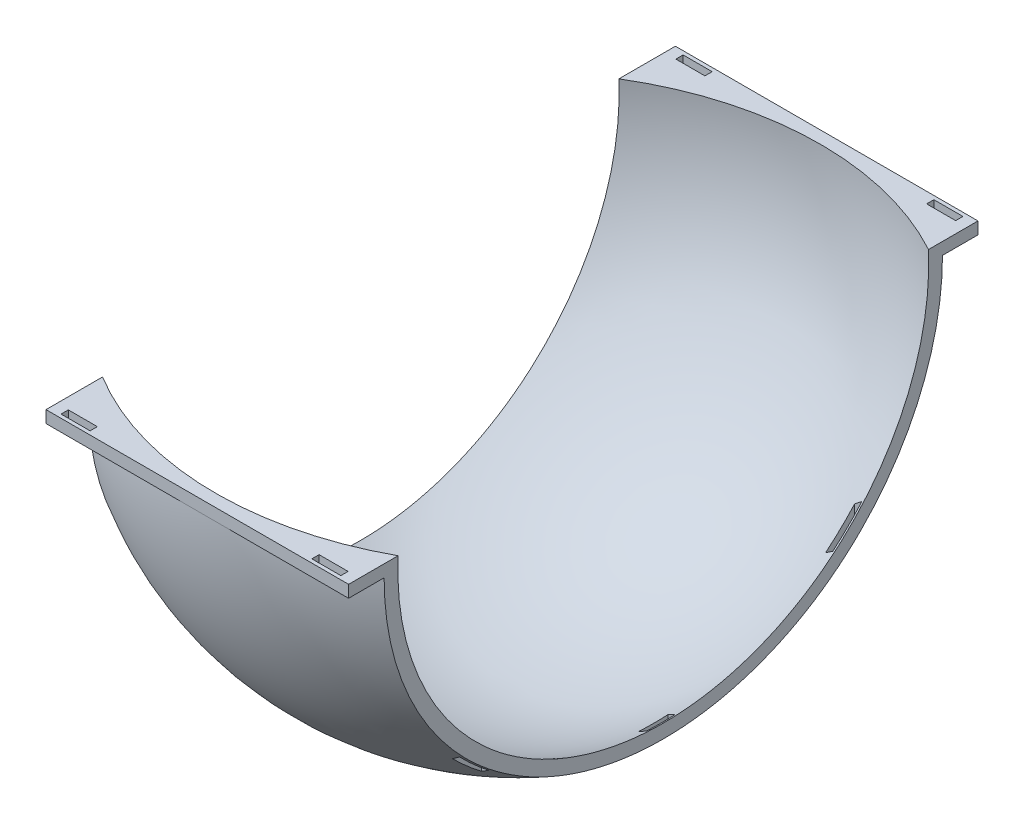
from build123d import *

# Parameters (mm, degrees)
EXTRUDE_1_DEPTH           = 200
CUT_EXTRUDE_START         = -130
CUT_EXTRUDE_1_OUTLINE_W   = 315
CUT_EXTRUDE_1_OUTLINE_H   = 262
CUT_EXTRUDE_1_DEPTH       = 65
CUT_EXTRUDE_START_2       = 65
CUT_EXTRUDE_1_2_OUTLINE_W = 315
CUT_EXTRUDE_1_2_OUTLINE_H = 262
CUT_EXTRUDE_1_2_DEPTH     = 65
SHELL_START               = 5
SHELL_1_OUTLINE_W         = 125
SHELL_1_OUTLINE_H         = 250
SHELL_1_DEPTH             = 190
EXTRUDE_7_DEPTH           = 3
SKETCH_5_R                = 5
EXTRUDE_8_DEPTH           = 5
SKETCH_6_R                = 38
SKETCH_6_R_2              = 16
EXTRUDE_9_DEPTH           = 15
SKETCH_7_R                = 10
SKETCH_7_R_2              = 5
EXTRUDE_10_DEPTH          = 15
SKETCH_8_R                = 1.5
CUT_EXTRUDE_2_DEPTH       = 10
CUT_EXTRUDE_7_DEPTH       = 252.296637488
CUT_EXTRUDE_7_DEPTH_BACK  = 252.296637488
SKETCH_9_W                = 293.588639073
SKETCH_9_H                = 220.370329066
CUT_EXTRUDE_START_3       = -15
SKETCH_14_R               = 38
CUT_EXTRUDE_8_DEPTH       = 15
CUT_EXTRUDE_10_DEPTH      = 196.000000033
CUT_EXTRUDE_10_DEPTH_BACK = 196.000000033
SKETCH_19_W               = 5
SKETCH_19_H               = 285.493998293
CUT_EXTRUDE_12_DEPTH      = 199.368344282
CUT_EXTRUDE_12_DEPTH_BACK = 199.368344282
SKETCH_20_W               = 12
SKETCH_20_H               = 3
CUT_EXTRUDE_13_DEPTH      = 199.368344282
CUT_EXTRUDE_13_DEPTH_BACK = 199.368344282
SKETCH_21_W               = 3
SKETCH_21_H               = 12


with BuildPart() as part:
    # 草图1 → 旋转1 (revolve)
    with BuildSketch(Plane.XY):
        with BuildLine():
            Line((0, 130), (0, -130))
            ThreePointArc((0, -130), (130, 0), (0, 130))
        make_face()
    revolve(axis=Axis((0, 130, 0), (0, -1, 0)))

    # 草图3 → 凸台-拉伸1 (add)
    with BuildSketch(Plane(origin=(0, 0, 0), x_dir=(1, 0, 0), z_dir=(0, 1, 0))):
        with BuildLine():
            Line((-120, -130), (120, -130))
            ThreePointArc((120, -130), (127.071067812, -127.071067812), (130, -120))
            Line((130, -120), (130, 120))
            ThreePointArc((130, 120), (127.071067812, 127.071067812), (120, 130))
            Line((120, 130), (-120, 130))
            ThreePointArc((-120, 130), (-127.071067812, 127.071067812), (-130, 120))
            Line((-130, 120), (-130, -120))
            ThreePointArc((-130, -120), (-127.071067812, -127.071067812), (-120, -130))
        make_face()
    extrude(amount=EXTRUDE_1_DEPTH)

    # 切除-拉伸1: read off the stored shape, not the designer's step
    # 切除-拉伸1 outline → 切除-拉伸1 (cut)
    with BuildSketch(Plane.YZ.offset(CUT_EXTRUDE_START)):
        with Locations((43.5, 0)):
            Rectangle(CUT_EXTRUDE_1_OUTLINE_W, CUT_EXTRUDE_1_OUTLINE_H)
    extrude(amount=CUT_EXTRUDE_1_DEPTH, mode=Mode.SUBTRACT)

    # Cut-Extrude 1 2 outline → Cut-Extrude 1 2 (cut)
    with BuildSketch(Plane.YZ.offset(CUT_EXTRUDE_START_2)):
        with Locations((43.5, 0)):
            Rectangle(CUT_EXTRUDE_1_2_OUTLINE_W, CUT_EXTRUDE_1_2_OUTLINE_H)
    extrude(amount=CUT_EXTRUDE_1_2_DEPTH, mode=Mode.SUBTRACT)

    # 抽壳1: read off the stored shape, not the designer's step
    # 抽壳1 outline → 抽壳1 (cut)
    with BuildSketch(Plane(origin=(0, 0, 0), x_dir=(1, 0, 0), z_dir=(0, 1, 0)).offset(SHELL_START)):
        with Locations((-2.5, 0)):
            Rectangle(SHELL_1_OUTLINE_W, SHELL_1_OUTLINE_H)
    extrude(amount=SHELL_1_DEPTH, mode=Mode.SUBTRACT)

    # Shell 1 2 outline → Shell 1 2 (revolve, cut)
    with BuildSketch(Plane.YX):
        with BuildLine():
            Line((109.658560943, 60.0000001), (0, 60.000000075))
            Line((0, 60.000000075), (0, -65.0000001))
            Line((0, -65.0000001), (106.770782459, -65.0000001))
            ThreePointArc((106.770782459, -65.0000001), (124.966656288, -2.887008165), (109.658560943, 60.0000001))
        make_face()
    revolve(axis=Axis((0, 0, 0), (1, 0, 0)), mode=Mode.SUBTRACT)

    # 草图4 → 凸台-拉伸7 (add)
    with BuildSketch(Plane.ZY.offset(65)):
        with BuildLine():
            Line((-130, 135), (-130, 0))
            Line((-130, 0), (-112.249721603, 0))
            ThreePointArc((-112.249721603, 0), (0, 112.249721603), (112.249721603, 0))
            Line((112.249721603, 0), (130, 0))
            Line((130, 0), (130, 135))
            Line((130, 135), (-130, 135))
        make_face()
    extrude(amount=-EXTRUDE_7_DEPTH)

    # 草图5 → 凸台-拉伸8 (add)
    with BuildSketch(Plane(origin=(0, 200, 0), x_dir=(1, 0, 0), z_dir=(0, 1, 0))):
        with Locations(Location((-45.093986565, 120.067321952, 0), (0, 0, 270))):
            Circle(SKETCH_5_R)
        with Locations(Location((-45.093986565, -120.067321952, 0), (0, 0, 90))):
            Circle(SKETCH_5_R)
        with Locations(Location((45.093986565, -120.067321952, 0), (0, 0, 270))):
            Circle(SKETCH_5_R)
        with Locations(Location((45.093986565, 120.067321952, 0), (0, 0, 90))):
            Circle(SKETCH_5_R)
    extrude(amount=EXTRUDE_8_DEPTH)

    # 草图6 → 凸台-拉伸9 (add)
    with BuildSketch(Plane.ZY.offset(-60)):
        with Locations(Location((0, 0, 0), (0, 0, 180))):
            Circle(SKETCH_6_R)
        Circle(SKETCH_6_R_2, mode=Mode.SUBTRACT)
    extrude(amount=EXTRUDE_9_DEPTH)

    # 草图7 → 凸台-拉伸10 (add)
    with BuildSketch(Plane.ZY.offset(-60)):
        with Locations(Location((-92.612625974, 96.844728871, 0), (0, 0, 180))):
            Circle(SKETCH_7_R)
        with Locations((-92.612625974, 96.844728871)):
            Circle(SKETCH_7_R_2, mode=Mode.SUBTRACT)
    extrude(amount=EXTRUDE_10_DEPTH)

    # 草图8 → 切除-拉伸2 (cut)
    with BuildSketch(Plane(origin=(0, 0, -130), x_dir=(-1, 0, 0), z_dir=(0, 0, -1))):
        with Locations((-26.070809392, 147.850864108)):
            Circle(SKETCH_8_R)
        with Locations((-7.111216047, 147.850864108)):
            Circle(SKETCH_8_R)
        with Locations((-26.070809392, 127.113089979)):
            Circle(SKETCH_8_R)
        with Locations((-7.111216047, 127.113089979)):
            Circle(SKETCH_8_R)
    extrude(amount=-CUT_EXTRUDE_2_DEPTH, mode=Mode.SUBTRACT)

    # 草图9 → 切除-拉伸7 (cut, two sides: drawn at the far end of the back side and taken through both)
    with BuildSketch(Plane(origin=(0, 0, 0), x_dir=(0, 0, -1), z_dir=(1, 0, 0)).offset(-CUT_EXTRUDE_7_DEPTH_BACK)):
        with Locations((-3.052780865, 115.185164533)):
            Rectangle(SKETCH_9_W, SKETCH_9_H)
    extrude(amount=CUT_EXTRUDE_7_DEPTH + CUT_EXTRUDE_7_DEPTH_BACK, mode=Mode.SUBTRACT)

    # 草图14 → 切除-拉伸8 (cut)
    with BuildSketch(Plane.ZY.offset(-45).offset(CUT_EXTRUDE_START_3)):
        Circle(SKETCH_14_R)
    extrude(amount=CUT_EXTRUDE_8_DEPTH, mode=Mode.SUBTRACT)

    # 草图19 → 切除-拉伸10 (cut, two sides: drawn at the far end of the back side and taken through both)
    with BuildSketch(Plane(origin=(0, 0, 0), x_dir=(1, 0, 0), z_dir=(0, 1, 0)).offset(-CUT_EXTRUDE_10_DEPTH_BACK)):
        with Locations((62.5, -7.079104538)):
            Rectangle(SKETCH_19_W, SKETCH_19_H)
    extrude(amount=CUT_EXTRUDE_10_DEPTH + CUT_EXTRUDE_10_DEPTH_BACK, mode=Mode.SUBTRACT)

    # 草图20 → 切除-拉伸12 (cut, two sides: drawn at the far end of the back side and taken through both)
    with BuildSketch(Plane(origin=(0, 5, 0), x_dir=(1, 0, 0), z_dir=(0, 1, 0)).offset(-CUT_EXTRUDE_12_DEPTH_BACK)):
        with Locations((-54.292813788, -126.986333392)):
            Rectangle(SKETCH_20_W, SKETCH_20_H)
        with Locations((49.292813788, -126.986333392)):
            Rectangle(SKETCH_20_W, SKETCH_20_H)
        with Locations((-54.292813788, 126.986333392)):
            Rectangle(SKETCH_20_W, SKETCH_20_H)
        with Locations((49.292813788, 126.986333392)):
            Rectangle(SKETCH_20_W, SKETCH_20_H)
    extrude(amount=CUT_EXTRUDE_12_DEPTH + CUT_EXTRUDE_12_DEPTH_BACK, mode=Mode.SUBTRACT)

    # 草图21 → 切除-拉伸13 (cut, two sides: drawn at the far end of the back side and taken through both)
    with BuildSketch(Plane(origin=(0, 5, 0), x_dir=(1, 0, 0), z_dir=(0, 1, 0)).offset(-CUT_EXTRUDE_13_DEPTH_BACK)):
        with Locations((57.445451133, 0)):
            Rectangle(SKETCH_21_W, SKETCH_21_H)
        with Locations((57.445451133, 77.088415128)):
            Rectangle(SKETCH_21_W, SKETCH_21_H)
        with Locations((57.445451133, -77.088415128)):
            Rectangle(SKETCH_21_W, SKETCH_21_H)
    extrude(amount=CUT_EXTRUDE_13_DEPTH + CUT_EXTRUDE_13_DEPTH_BACK, mode=Mode.SUBTRACT)


solid = part.part
